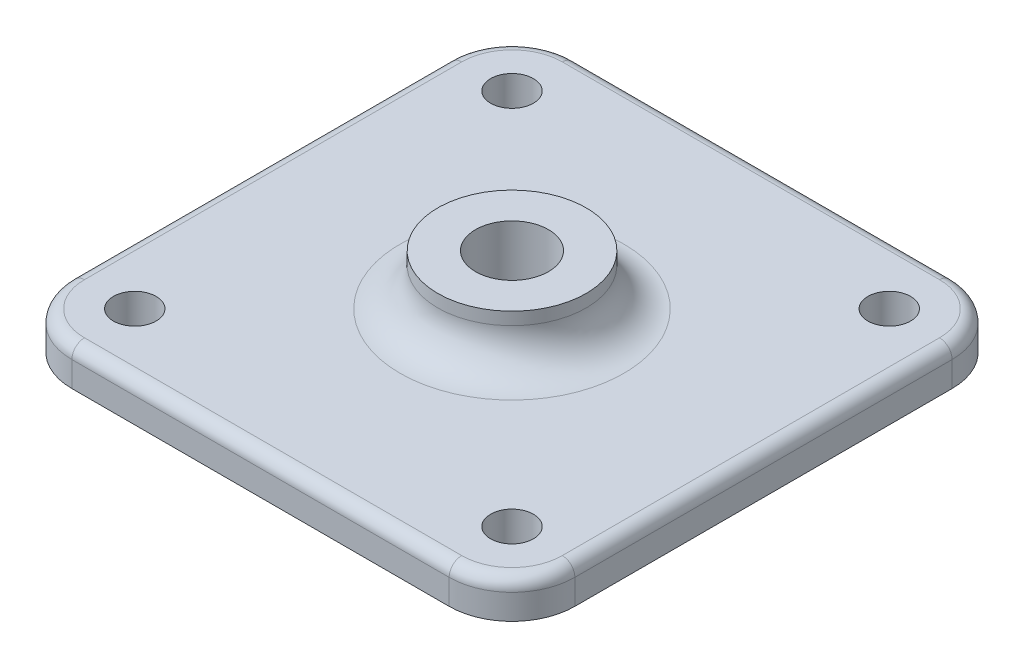
from build123d import *

# Parameters (mm, degrees)
SKETCH1_R           = 5.9
SKETCH1_R_2         = 2.9
BOSS_EXTRUDE1_DEPTH = 4
BOSS_EXTRUDE2_START = -3
SKETCH1_3_R         = 1.7
SKETCH1_3_R_2       = 2.9
BOSS_EXTRUDE2_DEPTH = 3
FILLET1_R           = 3
FILLET2_R           = 1


with BuildPart() as part:
    # Sketch1 → Boss-Extrude1 (new body)
    with BuildSketch(Plane(origin=(0, 0, 0), x_dir=(1, 0, 0), z_dir=(0, 1, 0))):
        Circle(SKETCH1_R)
        Circle(SKETCH1_R_2, mode=Mode.SUBTRACT)
    extrude(amount=BOSS_EXTRUDE1_DEPTH)

    # Sketch1<3> → Boss-Extrude2 (add)
    with BuildSketch(Plane(origin=(0, 0, 0), x_dir=(1, 0, 0), z_dir=(0, 1, 0)).offset(BOSS_EXTRUDE2_START)):
        with BuildLine():
            ThreePointArc((-20, -15), (-18.535533906, -18.535533906), (-15, -20))
            Line((-15, -20), (15, -20))
            ThreePointArc((15, -20), (18.535533906, -18.535533906), (20, -15))
            Line((20, -15), (20, 15))
            ThreePointArc((20, 15), (18.535533906, 18.535533906), (15, 20))
            Line((15, 20), (-15, 20))
            ThreePointArc((-15, 20), (-18.535533906, 18.535533906), (-20, 15))
            Line((-20, 15), (-20, -15))
        make_face()
        with Locations((-15, -15)):
            Circle(SKETCH1_3_R, mode=Mode.SUBTRACT)
        with Locations((15, -15)):
            Circle(SKETCH1_3_R, mode=Mode.SUBTRACT)
        with Locations((-15, 15)):
            Circle(SKETCH1_3_R, mode=Mode.SUBTRACT)
        with Locations((15, 15)):
            Circle(SKETCH1_3_R, mode=Mode.SUBTRACT)
        Circle(SKETCH1_3_R_2, mode=Mode.SUBTRACT)
    extrude(amount=BOSS_EXTRUDE2_DEPTH)

    # Fillet1
    fillet1_edges = [part.edges().sort_by_distance(p)[0] for p in [
        (-5.9, 0, 0),
    ]]
    fillet(fillet1_edges, radius=FILLET1_R)

    # Fillet2
    fillet2_edges = [part.edges().sort_by_distance(p)[0] for p in [
        (-18.535533906, 0, -18.535533906),
        (-20, 0, 0),
        (-18.535533906, 0, 18.535533906),
        (0, 0, 20),
        (18.535533906, 0, 18.535533906),
        (20, 0, 0),
        (18.535533906, 0, -18.535533906),
        (0, 0, -20),
    ]]
    fillet(fillet2_edges, radius=FILLET2_R)


solid = part.part
